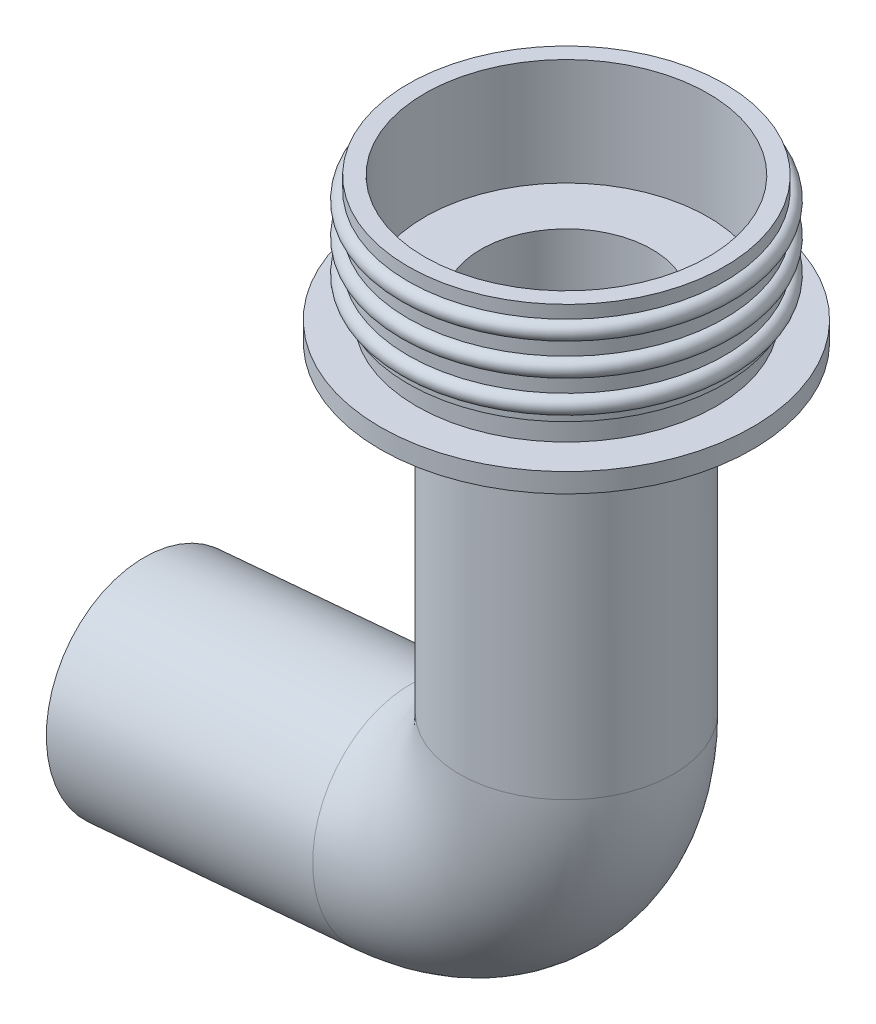
from build123d import *

# Parameters (mm, degrees)
SKETCH1_R           = 17.4
BOSS_EXTRUDE1_DEPTH = 1.81
SKETCH2_R           = 14.02
BOSS_EXTRUDE2_DEPTH = 2.2
SKETCH5_R           = 14.8
BOSS_EXTRUDE3_DEPTH = 9.5
SKETCH6_R           = 13.25
CUT_EXTRUDE1_DEPTH  = 10
SKETCH7_R           = 8
CUT_EXTRUDE2_DEPTH  = 27.561626456
SKETCH10_R          = 10
SKETCH10_R_2        = 8


with BuildPart() as part:
    # Sketch1 → Boss-Extrude1 (new body)
    with BuildSketch(Plane(origin=(0, 0, 0), x_dir=(1, 0, 0), z_dir=(0, 1, 0))):
        Circle(SKETCH1_R)
    extrude(amount=BOSS_EXTRUDE1_DEPTH)

    # Sketch2 → Boss-Extrude2 (add)
    with BuildSketch(Plane(origin=(0, 1.81, 0), x_dir=(1, 0, 0), z_dir=(0, 1, 0))):
        Circle(SKETCH2_R)
    extrude(amount=BOSS_EXTRUDE2_DEPTH)

    # Sketch5 → Boss-Extrude3 (add)
    with BuildSketch(Plane(origin=(0, 4.01, 0), x_dir=(1, 0, 0), z_dir=(0, 1, 0))):
        Circle(SKETCH5_R)
    extrude(amount=BOSS_EXTRUDE3_DEPTH)

    # Sketch6 → Cut-Extrude1 (cut)
    with BuildSketch(Plane(origin=(0, 13.51, 0), x_dir=(1, 0, 0), z_dir=(0, 1, 0))):
        Circle(SKETCH6_R)
    extrude(amount=-CUT_EXTRUDE1_DEPTH, mode=Mode.SUBTRACT)

    # Sketch7 → Cut-Extrude2 (cut, through all)
    with BuildSketch(Plane(origin=(0, 3.51, 0), x_dir=(1, 0, 0), z_dir=(0, 1, 0))):
        Circle(SKETCH7_R)
    extrude(amount=-CUT_EXTRUDE2_DEPTH, mode=Mode.SUBTRACT)

    # Sketch8 → Revolve1 (revolve)
    with BuildSketch(Plane(origin=(0, 0, 0), x_dir=(0, 0, -1), z_dir=(1, 0, 0))):
        with BuildLine():
            Line((-14.8, 12.31), (-14.8, 10.71))
            ThreePointArc((-14.8, 10.71), (-15.6, 11.51), (-14.8, 12.31))
        make_face()
        with BuildLine():
            Line((-14.8, 7.71), (-14.8, 9.31))
            ThreePointArc((-14.8, 9.31), (-15.6, 8.51), (-14.8, 7.71))
        make_face()
        with BuildLine():
            Line((-14.8, 4.71), (-14.8, 6.31))
            ThreePointArc((-14.8, 6.31), (-15.6, 5.51), (-14.8, 4.71))
        make_face()
    revolve(axis=Axis((0, 3.51, 0), (0, 1, 0)))

    # Sweep1: sweep along a path in Sketch9
    with BuildLine(Plane.XY) as sweep1_path:
        Line((0, 0), (0, -30))
        ThreePointArc((0, -30), (-3.940839948, -40.133853114), (-13.692663859, -44.942920471))
        Line((-13.692663859, -44.942920471), (-38.597531311, -47.12181404))
    # Sketch10 → Sweep1 (sweep)
    with BuildSketch(Plane.XZ):
        Circle(SKETCH10_R)
        Circle(SKETCH10_R_2, mode=Mode.SUBTRACT)
    sweep(path=sweep1_path.line)


solid = part.part
